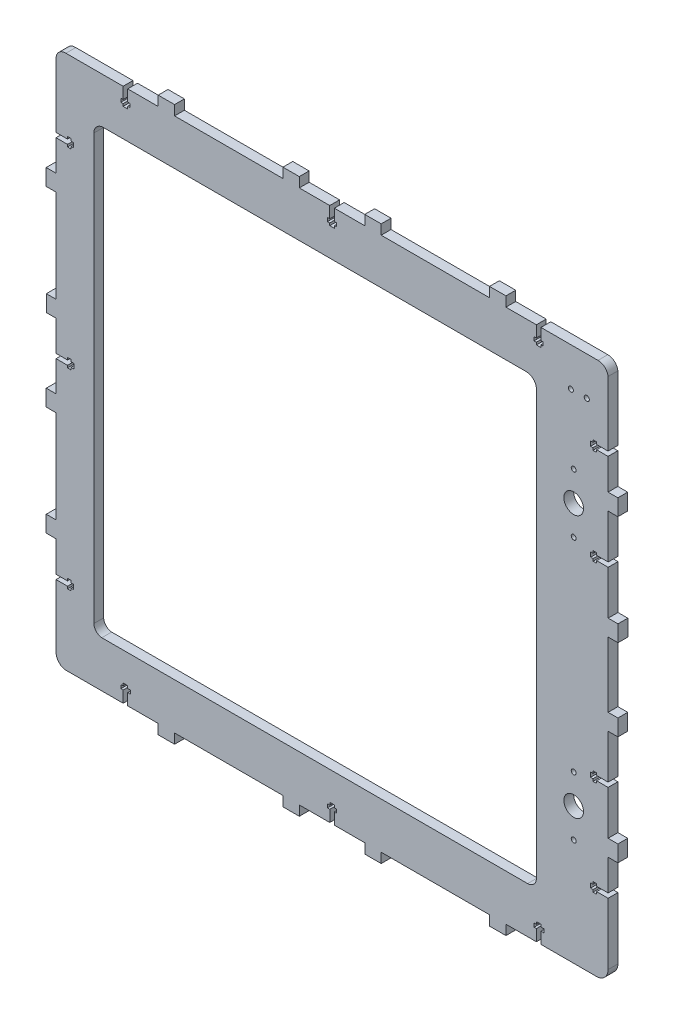
from build123d import *

# Parameters (mm, degrees)
SKETCH_1_R      = 1.499776535
SKETCH_1_R_2    = 5.99910614
SKETCH_1_R_3    = 1.549769086
EXTRUDE_1_DEPTH = 6


with BuildPart() as part:
    # Эскиз1 → Бобышка-Вытянуть1 (new body)
    with BuildSketch(Plane.XY):
        with BuildLine():
            Line((-162.382285021, 162.308435431), (-127.466462939, 162.308435431))
            Line((-127.466462939, 162.308435431), (-127.466462939, 155.298849136))
            Line((-127.466462939, 155.298849136), (-128.864855376, 155.297077675))
            Line((-128.864855376, 155.297077675), (-128.863669545, 153.098919499))
            Line((-128.863669545, 153.098919499), (-127.464951423, 153.098445342))
            Line((-127.464951423, 153.098445342), (-127.463607621, 151.656044553))
            Line((-127.463607621, 151.656044553), (-124.664288255, 151.656955119))
            Line((-124.664288255, 151.656955119), (-124.664189831, 153.099608705))
            Line((-124.664189831, 153.099608705), (-123.265334726, 153.100225766))
            Line((-123.265334726, 153.100225766), (-123.2674438, 155.299538526))
            Line((-123.2674438, 155.299538526), (-124.666462939, 155.299859173))
            Line((-124.666462939, 155.299859173), (-124.666462939, 162.315577998))
            Line((-124.666462939, 162.315577998), (-106.066462939, 162.315577998))
            Line((-106.066462939, 162.315577998), (-106.066462939, 168.315577998))
            Line((-106.066462939, 168.315577998), (-96.066462939, 168.315577998))
            Line((-96.066462939, 168.315577998), (-96.066462939, 162.316471857))
            Line((-96.066462939, 162.316471857), (-29.916462939, 162.316471857))
            Line((-29.916462939, 162.316471857), (-29.916462939, 168.316471857))
            Line((-29.916462939, 168.316471857), (-19.916462939, 168.316471857))
            Line((-19.916462939, 168.316471857), (-19.916462939, 162.320718098))
            Line((-19.916462939, 162.320718098), (-1.326462939, 162.320718098))
            Line((-1.326462939, 162.320718098), (-1.326462939, 155.305145594))
            Line((-1.326462939, 155.305145594), (-2.725921754, 155.304116609))
            Line((-2.725921754, 155.304116609), (-2.727383545, 153.105286347))
            Line((-2.727383545, 153.105286347), (-1.328170916, 153.103765038))
            Line((-1.328170916, 153.103765038), (-1.328160034, 151.661510932))
            Line((-1.328160034, 151.661510932), (1.47030276, 151.659356736))
            Line((1.47030276, 151.659356736), (1.472937425, 153.101274167))
            Line((1.472937425, 153.101274167), (2.870795507, 153.101809286))
            Line((2.870795507, 153.101809286), (2.87098851, 155.299105648))
            Line((2.87098851, 155.299105648), (1.473537061, 155.30215962))
            Line((1.473537061, 155.30215962), (1.473537061, 162.308600642))
            Line((1.473537061, 162.308600642), (20.063537061, 162.308600642))
            Line((20.063537061, 162.308600642), (20.063537061, 168.322619299))
            Line((20.063537061, 168.322619299), (30.063537061, 168.322619299))
            Line((30.063537061, 168.322619299), (30.063537061, 162.322619299))
            Line((30.063537061, 162.322619299), (96.213537061, 162.322619299))
            Line((96.213537061, 162.322619299), (96.213537061, 168.322619299))
            Line((96.213537061, 168.322619299), (106.213537061, 168.322619299))
            Line((106.213537061, 168.322619299), (106.213537061, 162.34366769))
            Line((106.213537061, 162.34366769), (124.813537061, 162.34366769))
            Line((124.813537061, 162.34366769), (124.813537061, 155.329079255))
            Line((124.813537061, 155.329079255), (123.414078503, 155.327745522))
            Line((123.414078503, 155.327745522), (123.413095533, 153.128914993))
            Line((123.413095533, 153.128914993), (124.81230846, 153.127698379))
            Line((124.81230846, 153.127698379), (124.812633409, 151.68544431))
            Line((124.812633409, 151.68544431), (127.611096606, 151.683899511))
            Line((127.611096606, 151.683899511), (127.613417277, 153.125817482))
            Line((127.613417277, 153.125817482), (129.011275209, 153.126657001))
            Line((129.011275209, 153.126657001), (129.010989142, 155.323953823))
            Line((129.010989142, 155.323953823), (127.613537061, 155.326703485))
            Line((127.613537061, 155.326703485), (127.613537061, 162.337648251))
            Line((127.613537061, 162.337648251), (162.438807528, 162.337648251))
            ThreePointArc((162.438807528, 162.337648251), (166.549989732, 160.77188103), (168.573537061, 156.865642134))
            Line((168.573537061, 156.865642134), (168.573537061, 117.437648251))
            Line((168.573537061, 117.437648251), (161.571043584, 117.437648251))
            Line((161.571043584, 117.437648251), (161.571043584, 118.837543693))
            Line((161.571043584, 118.837543693), (159.370548873, 118.837543693))
            Line((159.370548873, 118.837543693), (159.371370823, 117.437871278))
            Line((159.371370823, 117.437871278), (157.871594546, 117.436990543))
            Line((157.871594546, 117.436990543), (157.873238046, 114.638324734))
            Line((157.873238046, 114.638324734), (159.373014323, 114.639205469))
            Line((159.373014323, 114.639205469), (159.373836881, 113.238496918))
            Line((159.373836881, 113.238496918), (161.573509557, 113.238443586))
            Line((161.573509557, 113.238443586), (161.573543482, 114.637648251))
            Line((161.573543482, 114.637648251), (168.562627133, 114.637648251))
            Line((168.562627133, 114.637648251), (168.562627133, 95.737648251))
            Line((168.562627133, 95.737648251), (174.562627133, 95.737648251))
            Line((174.562627133, 95.737648251), (174.562627133, 85.737648251))
            Line((174.562627133, 85.737648251), (168.641214916, 85.737648251))
            Line((168.641214916, 85.737648251), (168.641214916, 58.837648251))
            Line((168.641214916, 58.837648251), (161.657486314, 58.837648251))
            Line((161.657486314, 58.837648251), (161.657486314, 60.237543693))
            Line((161.657486314, 60.237543693), (159.456991602, 60.237543693))
            Line((159.456991602, 60.237543693), (159.457813552, 58.837871278))
            Line((159.457813552, 58.837871278), (157.958037275, 58.836990543))
            Line((157.958037275, 58.836990543), (157.959680776, 56.038324734))
            Line((157.959680776, 56.038324734), (159.459457052, 56.039205469))
            Line((159.459457052, 56.039205469), (159.46027961, 54.638496918))
            Line((159.46027961, 54.638496918), (161.659952287, 54.638443586))
            Line((161.659952287, 54.638443586), (161.659986211, 56.037648251))
            Line((161.659986211, 56.037648251), (168.641214916, 56.037648251))
            Line((168.641214916, 56.037648251), (168.641214916, 29.137648251))
            Line((168.641214916, 29.137648251), (174.641214916, 29.137648251))
            Line((174.641214916, 29.137648251), (174.641214916, 19.137648251))
            Line((174.641214916, 19.137648251), (168.592443972, 19.137648251))
            Line((168.592443972, 19.137648251), (168.592443972, -20.662351749))
            Line((168.592443972, -20.662351749), (174.592443972, -20.662351749))
            Line((174.592443972, -20.662351749), (174.592443972, -30.662351749))
            Line((174.592443972, -30.662351749), (168.592443972, -30.662351749))
            Line((168.592443972, -30.662351749), (168.592443972, -57.562351749))
            Line((168.592443972, -57.562351749), (161.586415294, -57.562351749))
            Line((161.586415294, -57.562351749), (161.586415294, -56.162456307))
            Line((161.586415294, -56.162456307), (159.385920583, -56.162456307))
            Line((159.385920583, -56.162456307), (159.386742533, -57.562128722))
            Line((159.386742533, -57.562128722), (157.886966256, -57.563009457))
            Line((157.886966256, -57.563009457), (157.888609757, -60.361675265))
            Line((157.888609757, -60.361675265), (159.388386033, -60.36079453))
            Line((159.388386033, -60.36079453), (159.389208591, -61.761503082))
            Line((159.389208591, -61.761503082), (161.588881267, -61.761556414))
            Line((161.588881267, -61.761556414), (161.588915192, -60.362351749))
            Line((161.588915192, -60.362351749), (168.592443972, -60.362351749))
            Line((168.592443972, -60.362351749), (168.592443972, -87.262351749))
            Line((168.592443972, -87.262351749), (174.592195482, -87.262351749))
            Line((174.592195482, -87.262351749), (174.592195482, -97.262351749))
            Line((174.592195482, -97.262351749), (168.592195482, -97.262351749))
            Line((168.592195482, -97.262351749), (168.592195482, -116.162351749))
            Line((168.592195482, -116.162351749), (161.593007793, -116.162351749))
            Line((161.593007793, -116.162351749), (161.592769739, -114.762456327))
            Line((161.592769739, -114.762456327), (159.39227506, -114.762830525))
            Line((159.39227506, -114.762830525), (159.393335026, -116.16250278))
            Line((159.393335026, -116.16250278), (157.893558921, -116.163638554))
            Line((157.893558921, -116.163638554), (157.895678338, -118.962304042))
            Line((157.895678338, -118.962304042), (159.395454443, -118.961168268))
            Line((159.395454443, -118.961168268), (159.396515194, -120.361876659))
            Line((159.396515194, -120.361876659), (161.596187747, -120.361555934))
            Line((161.596187747, -120.361555934), (161.595983735, -118.962351749))
            Line((161.595983735, -118.962351749), (168.592443972, -118.962351749))
            Line((168.592443972, -118.962351749), (168.592443972, -156.700415901))
            ThreePointArc((168.592443972, -156.700415901), (166.409828255, -161.849836441), (161.191578988, -163.862351749))
            Line((161.191578988, -163.862351749), (127.632443972, -163.862351749))
            Line((127.632443972, -163.862351749), (127.632443972, -156.863393378))
            Line((127.632443972, -156.863393378), (129.324414844, -156.863393378))
            Line((129.324414844, -156.863393378), (129.32404194, -154.670504706))
            Line((129.32404194, -154.670504706), (127.631705877, -154.671786305))
            Line((127.631705877, -154.671786305), (127.630569935, -153.171788566))
            Line((127.630569935, -153.171788566), (124.831904447, -153.173907984))
            Line((124.831904447, -153.173907984), (124.833040221, -154.673684089))
            Line((124.833040221, -154.673684089), (123.43233183, -154.674744839))
            Line((123.43233183, -154.674744839), (123.432652555, -156.874417479))
            Line((123.432652555, -156.874417479), (124.832443972, -156.874213381))
            Line((124.832443972, -156.874213381), (124.832443972, -163.870671955))
            Line((124.832443972, -163.870671955), (106.232443972, -163.870671955))
            Line((106.232443972, -163.870671955), (106.232443972, -169.890505498))
            Line((106.232443972, -169.890505498), (96.232443972, -169.890505498))
            Line((96.232443972, -169.890505498), (96.232443972, -163.890505498))
            Line((96.232443972, -163.890505498), (30.082443972, -163.890505498))
            Line((30.082443972, -163.890505498), (30.082443972, -169.890505498))
            Line((30.082443972, -169.890505498), (20.082443972, -169.890505498))
            Line((20.082443972, -169.890505498), (20.082443972, -163.891399358))
            Line((20.082443972, -163.891399358), (1.492443972, -163.891399358))
            Line((1.492443972, -163.891399358), (1.492443972, -156.892440987))
            Line((1.492443972, -156.892440987), (2.891754343, -156.892440987))
            Line((2.891754343, -156.892440987), (2.891377964, -154.679114652))
            Line((2.891377964, -154.679114652), (1.491705709, -154.680174618))
            Line((1.491705709, -154.680174618), (1.490569935, -153.180398513))
            Line((1.490569935, -153.180398513), (-1.308095553, -153.182517931))
            Line((-1.308095553, -153.182517931), (-1.306959779, -154.682294036))
            Line((-1.306959779, -154.682294036), (-2.70766817, -154.683354786))
            Line((-2.70766817, -154.683354786), (-2.707347445, -156.883027425))
            Line((-2.707347445, -156.883027425), (-1.307556028, -156.882823328))
            Line((-1.307556028, -156.882823328), (-1.307556028, -163.879281902))
            Line((-1.307556028, -163.879281902), (-19.897556028, -163.879281902))
            Line((-19.897556028, -163.879281902), (-19.897556028, -169.883528143))
            Line((-19.897556028, -169.883528143), (-29.897556028, -169.883528143))
            Line((-29.897556028, -169.883528143), (-29.897556028, -163.883528143))
            Line((-29.897556028, -163.883528143), (-96.047556028, -163.883528143))
            Line((-96.047556028, -163.883528143), (-96.047556028, -169.883528143))
            Line((-96.047556028, -169.883528143), (-106.047556028, -169.883528143))
            Line((-106.047556028, -169.883528143), (-106.047556028, -163.884422002))
            Line((-106.047556028, -163.884422002), (-124.647556028, -163.884422002))
            Line((-124.647556028, -163.884422002), (-124.647556028, -156.885463632))
            Line((-124.647556028, -156.885463632), (-122.878505553, -156.885463632))
            Line((-122.878505553, -156.885463632), (-122.878878657, -154.691397319))
            Line((-122.878878657, -154.691397319), (-124.648294079, -154.69273729))
            Line((-124.648294079, -154.69273729), (-124.649430065, -153.19268118))
            Line((-124.649430065, -153.19268118), (-127.448095553, -153.194800598))
            Line((-127.448095553, -153.194800598), (-127.446959779, -154.694576703))
            Line((-127.446959779, -154.694576703), (-128.84766817, -154.695637453))
            Line((-128.84766817, -154.695637453), (-128.847347445, -156.895310092))
            Line((-128.847347445, -156.895310092), (-127.447556028, -156.895105995))
            Line((-127.447556028, -156.895105995), (-127.447556028, -163.891564569))
            Line((-127.447556028, -163.891564569), (-163.338370559, -163.891564569))
            ThreePointArc((-163.338370559, -163.891564569), (-167.000956905, -161.436911886), (-168.407556028, -157.258235367))
            Line((-168.407556028, -157.258235367), (-168.407556028, -118.991564569))
            Line((-168.407556028, -118.991564569), (-161.404707029, -118.991564569))
            Line((-161.404707029, -118.991564569), (-161.404707029, -120.39146001))
            Line((-161.404707029, -120.39146001), (-159.204212318, -120.39146001))
            Line((-159.204212318, -120.39146001), (-159.205033828, -118.992535911))
            Line((-159.205033828, -118.992535911), (-157.684362147, -118.991642905))
            Line((-157.684362147, -118.991642905), (-157.689437775, -116.191642905))
            Line((-157.689437775, -116.191642905), (-159.209014212, -116.192535267))
            Line((-159.209014212, -116.192535267), (-159.20983677, -114.791826469))
            Line((-159.20983677, -114.791826469), (-161.409509432, -114.791773136))
            Line((-161.409509432, -114.791773136), (-161.409543371, -116.191564569))
            Line((-161.409543371, -116.191564569), (-168.407804518, -116.191564569))
            Line((-168.407804518, -116.191564569), (-168.407804518, -97.431564569))
            Line((-168.407804518, -97.431564569), (-174.407804518, -97.431564569))
            Line((-174.407804518, -97.431564569), (-174.407804518, -87.431564569))
            Line((-174.407804518, -87.431564569), (-168.407556028, -87.431564569))
            Line((-168.407556028, -87.431564569), (-168.407556028, -30.781564569))
            Line((-168.407556028, -30.781564569), (-174.407556028, -30.781564569))
            Line((-174.407556028, -30.781564569), (-174.407556028, -20.781564569))
            Line((-174.407556028, -20.781564569), (-168.407556028, -20.781564569))
            Line((-168.407556028, -20.781564569), (-168.407556028, -2.191564569))
            Line((-168.407556028, -2.191564569), (-161.410385376, -2.191564569))
            Line((-161.410385376, -2.191564569), (-161.410147322, -3.59145999))
            Line((-161.410147322, -3.59145999), (-159.209652643, -3.591085793))
            Line((-159.209652643, -3.591085793), (-159.210712608, -2.191413538))
            Line((-159.210712608, -2.191413538), (-157.416000436, -2.19005441))
            Line((-157.416000436, -2.19005441), (-157.425703992, 0.764902156))
            Line((-157.425703992, 0.764902156), (-159.162809024, 0.763586653))
            Line((-159.162809024, 0.763586653), (-159.163751828, 2.008547574))
            Line((-159.163751828, 2.008547574), (-161.363424467, 2.008226849))
            Line((-161.363424467, 2.008226849), (-161.363220369, 0.608435431))
            Line((-161.363220369, 0.608435431), (-168.407556028, 0.608435431))
            Line((-168.407556028, 0.608435431), (-168.407556028, 19.198435431))
            Line((-168.407556028, 19.198435431), (-174.358785084, 19.198435431))
            Line((-174.358785084, 19.198435431), (-174.358785084, 29.198435431))
            Line((-174.358785084, 29.198435431), (-168.358785084, 29.198435431))
            Line((-168.358785084, 29.198435431), (-168.358785084, 85.848435431))
            Line((-168.358785084, 85.848435431), (-174.437372867, 85.848435431))
            Line((-174.437372867, 85.848435431), (-174.437372867, 95.848435431))
            Line((-174.437372867, 95.848435431), (-168.437372867, 95.848435431))
            Line((-168.437372867, 95.848435431), (-168.437372867, 114.608435431))
            Line((-168.437372867, 114.608435431), (-161.406652343, 114.608435431))
            Line((-161.406652343, 114.608435431), (-161.406652343, 113.20853999))
            Line((-161.406652343, 113.20853999), (-159.206157632, 113.20853999))
            Line((-159.206157632, 113.20853999), (-159.206979581, 114.608212405))
            Line((-159.206979581, 114.608212405), (-157.706725947, 114.60909342))
            Line((-157.706725947, 114.60909342), (-157.708846286, 117.408974958))
            Line((-157.708846286, 117.408974958), (-159.208622847, 117.407839183))
            Line((-159.208622847, 117.407839183), (-159.209683598, 118.808547574))
            Line((-159.209683598, 118.808547574), (-161.409356237, 118.808226849))
            Line((-161.409356237, 118.808226849), (-161.409152139, 117.408435431))
            Line((-161.409152139, 117.408435431), (-168.426462939, 117.408435431))
            Line((-168.426462939, 117.408435431), (-168.426462939, 156.695916071))
            ThreePointArc((-168.426462939, 156.695916071), (-166.577388219, 160.765406451), (-162.382285021, 162.308435431))
        make_face()
        with Locations((147.595796078, 97.412920389)):
            Circle(SKETCH_1_R, mode=Mode.SUBTRACT)
        with Locations((147.601621152, 61.418957204)):
            Circle(SKETCH_1_R, mode=Mode.SUBTRACT)
        with Locations((147.584254832, 79.405702587)):
            Circle(SKETCH_1_R_2, mode=Mode.SUBTRACT)
        with Locations((147.601621152, -98.687627128)):
            Circle(SKETCH_1_R, mode=Mode.SUBTRACT)
        with Locations((147.584254832, -80.700881745)):
            Circle(SKETCH_1_R_2, mode=Mode.SUBTRACT)
        with Locations((147.595796078, -62.693663943)):
            Circle(SKETCH_1_R, mode=Mode.SUBTRACT)
        with Locations((145.873537061, 138.837648251)):
            Circle(SKETCH_1_R_3, mode=Mode.SUBTRACT)
        with Locations((155.573537061, 138.837648251)):
            Circle(SKETCH_1_R_3, mode=Mode.SUBTRACT)
        with BuildLine():
            Line((-145.346896139, 128.637688118), (-145.346896139, -130.703427214))
            ThreePointArc((-145.346896139, -130.703427214), (-143.86599811, -134.143169764), (-140.491160122, -135.766547824))
            Line((-140.491160122, -135.766547824), (119.465267875, -135.766547824))
            ThreePointArc((119.465267875, -135.766547824), (123.199713749, -134.248357992), (124.815536593, -130.555107))
            Line((124.815536593, -130.555107), (124.815536593, 128.790043446))
            ThreePointArc((124.815536593, 128.790043446), (122.861386425, 132.837018973), (118.680884629, 134.486297158))
            Line((118.680884629, 134.486297158), (-139.349726494, 134.486297158))
            ThreePointArc((-139.349726494, 134.486297158), (-143.580749241, 132.825735736), (-145.346896139, 128.637688118))
        make_face(mode=Mode.SUBTRACT)
    extrude(amount=EXTRUDE_1_DEPTH)


solid = part.part
